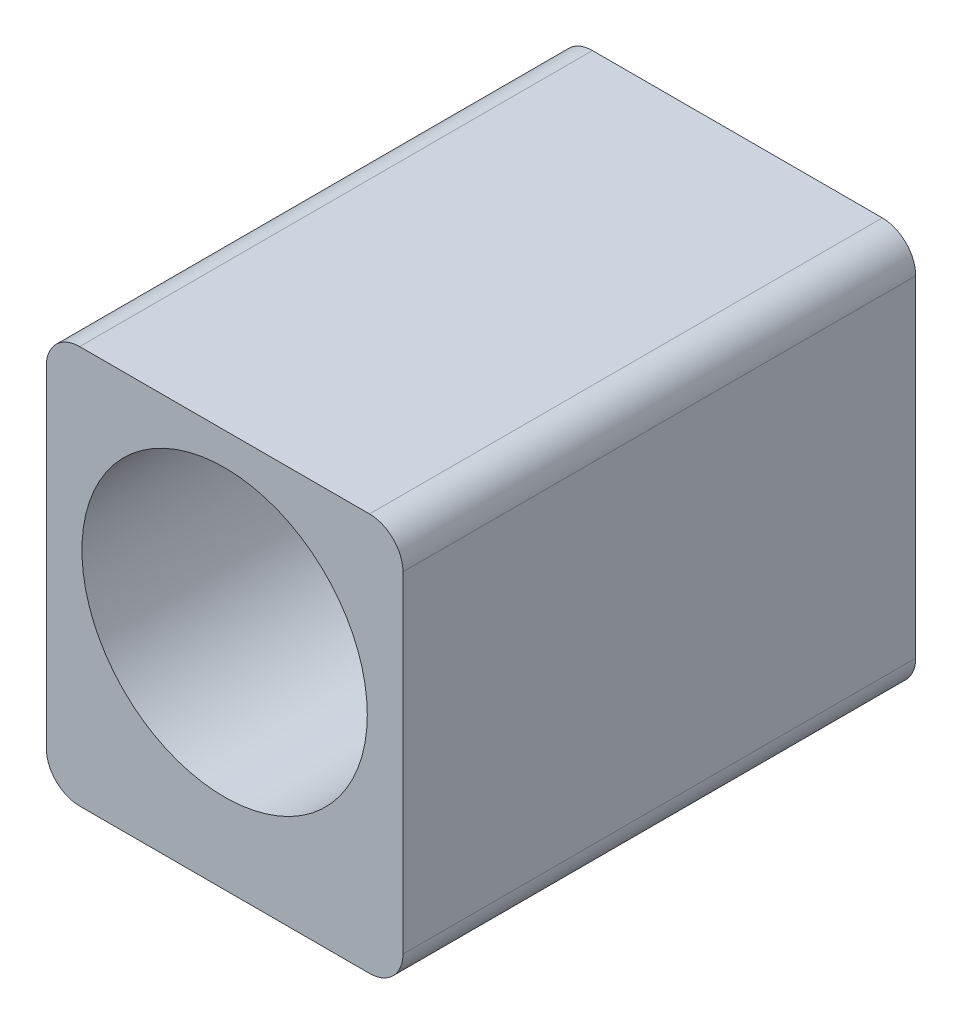
from build123d import *

# Parameters (mm, degrees)
SKETCH1_R           = 12.8
BOSS_EXTRUDE1_DEPTH = 23
SKETCH2_R           = 2
CUT_EXTRUDE1_DEPTH  = 7.5


with BuildPart() as part:
    # Sketch1 → Boss-Extrude1 (new, symmetric)
    with BuildSketch(Plane.XY):
        with BuildLine():
            Line((-13, -19.999), (13, -19.999))
            ThreePointArc((13, -19.999), (15.121320344, -19.120320344), (16, -16.999))
            Line((16, -16.999), (16, 12.7))
            ThreePointArc((16, 12.7), (15.121320344, 14.821320344), (13, 15.7))
            Line((13, 15.7), (-13, 15.7))
            ThreePointArc((-13, 15.7), (-15.121320344, 14.821320344), (-16, 12.7))
            Line((-16, 12.7), (-16, -16.999))
            ThreePointArc((-16, -16.999), (-15.121320344, -19.120320344), (-13, -19.999))
        make_face()
        Circle(SKETCH1_R, mode=Mode.SUBTRACT)
    extrude(amount=BOSS_EXTRUDE1_DEPTH, both=True)

    # Sketch2 → Cut-Extrude1 (cut)
    with BuildSketch(Plane(origin=(0, -19.999, 0), x_dir=(1, 0, 0), z_dir=(0, 1, 0))):
        with Locations((12, -17.5)):
            Circle(SKETCH2_R)
        with Locations((-12, 17.5)):
            Circle(SKETCH2_R)
    extrude(amount=CUT_EXTRUDE1_DEPTH, mode=Mode.SUBTRACT)


solid = part.part
